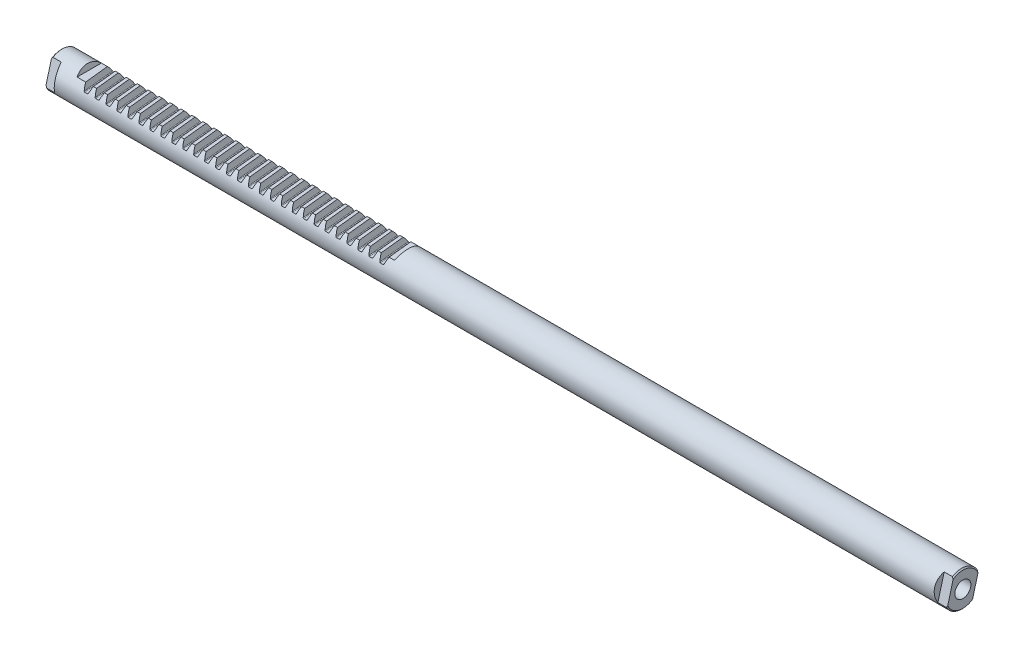
from build123d import *

# Parameters (mm, degrees)
ENL_V_MAT_EXTRU_1_DEPTH    = 12.5
ENL_V_MAT_EXTRU_2_DEPTH    = 12.5
R_P_TITION_LIN_AIRE2_COUNT = 28
R_P_TITION_LIN_AIRE2_PITCH = 6.8
ENL_V_MAT_EXTRU_3_DEPTH    = 12.5


with BuildPart() as part:
    # Esquisse1 → Base-Révolution (revolve)
    with BuildSketch(Plane.XY):
        Polygon((-257.113248654, 0), (257.113248654, 0), (260, 5), (280, 5), (280, 10.292893219), (279.292893219, 11), (-279.292893219, 11), (-280, 10.292893219), (-280, 5), (-260, 5), align=None)
    revolve(axis=Axis((301, 0, 0), (-1, 0, 0)))

    # Esquisse2 → Enlèv. mat.-Extru.1 (cut, symmetric)
    with BuildSketch(Plane.XY):
        Polygon((-262.544119063, 8), (-65.455880937, 8), (-64, 12), (-264, 12), align=None)
    extrude(amount=ENL_V_MAT_EXTRU_1_DEPTH, both=True, mode=Mode.SUBTRACT)

    # Esquisse4 → Enlèv. mat.-Extru.2 (cut, symmetric)
    with BuildSketch(Plane(origin=(-514.586649005, 0, 26.968343523), x_dir=(-0.9945218953682734, 0, 0.10452846326765228), z_dir=(-0.10452846326765229, 0, -0.9945218953682734))):
        with BuildLine():
            Line((-262.8, 8), (-261.691343001, 4.953989928))
            ThreePointArc((-261.691343001, 4.953989928), (-261.508284908, 4.715423978), (-261.22149669, 4.625))
            Line((-261.22149669, 4.625), (-259.57850331, 4.625))
            ThreePointArc((-259.57850331, 4.625), (-259.291715092, 4.715423978), (-259.108656999, 4.953989928))
            Line((-259.108656999, 4.953989928), (-258, 8))
            Line((-258, 8), (-262.8, 8))
        make_face()
    enl_v_mat_extru_2 = extrude(amount=ENL_V_MAT_EXTRU_2_DEPTH, both=True, mode=Mode.SUBTRACT)

    # Répétition linéaire2: Enlèv. mat.-Extru.2 ×28
    with Locations(*[(i * R_P_TITION_LIN_AIRE2_PITCH, 0, 0) for i in range(1, R_P_TITION_LIN_AIRE2_COUNT)]):
        add(enl_v_mat_extru_2, mode=Mode.SUBTRACT)

    # Esquisse6 → Enlèv. mat.-Extru.3 (cut, symmetric)
    with BuildSketch(Plane(origin=(0, 0, 0), x_dir=(-1, 0, 0), z_dir=(0, 0.9659258262890673, -0.2588190451025247))):
        Polygon((-283, 8), (-274.183821406, 8), (-272, 14), (-283, 14), align=None)
        Polygon((274.183821406, 8), (272, 14), (283, 14), (283, 8), align=None)
        Polygon((-283, -14), (-283, -8), (-274.183821406, -8), (-272, -14), align=None)
        Polygon((274.183821406, -8), (272, -14), (283, -14), (283, -8), align=None)
    extrude(amount=ENL_V_MAT_EXTRU_3_DEPTH, both=True, mode=Mode.SUBTRACT)


solid = part.part
